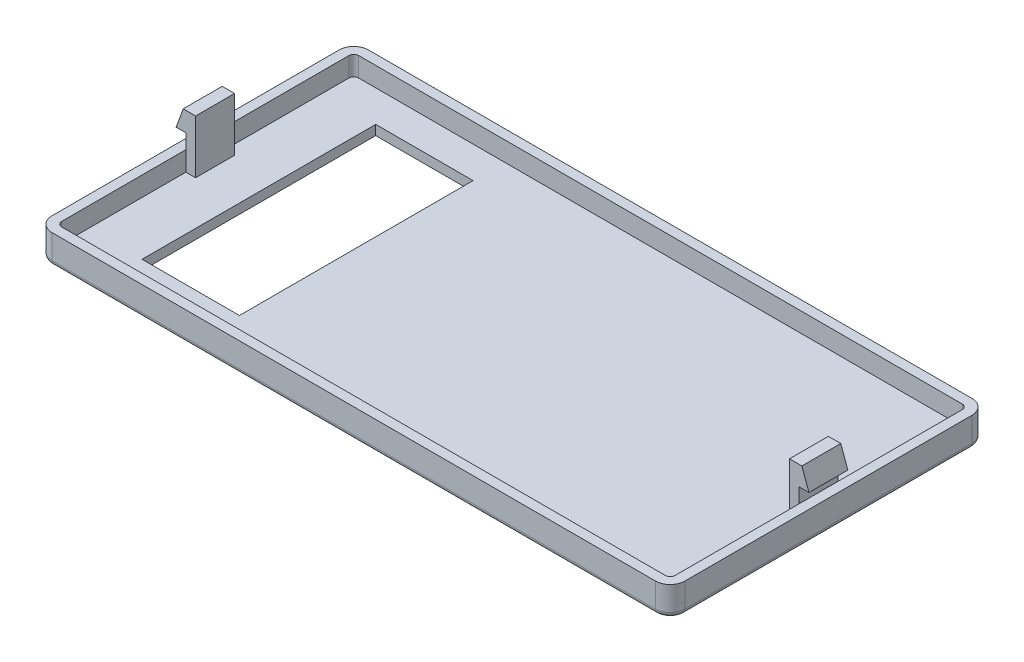
from build123d import *

# Parameters (mm, degrees)
SKETCH_1_W                  = 130
SKETCH_1_H                  = 65
EXTRUDE_1_DEPTH             = 6
SKETCH_2_W                  = 126
SKETCH_2_H                  = 61
CUT_EXTRUDE_1_DEPTH         = 4
FILLET_1_R                  = 1
SKETCH_9_W                  = 20
SKETCH_9_H                  = 48
CUT_EXTRUDE_3_DEPTH         = 2
SKETCH_6_W                  = 2
SKETCH_6_H                  = 8
EXTRUDE_2_DEPTH             = 11
SKETCH_12_W                 = 8
SKETCH_12_H                 = 4
EXTRUDE_4_DEPTH             = 2
CHAMFER_2_SIZE2             = 4
CHAMFER_2_SIZE              = 1.455880937
CHAMFER_2_OF_MIRROR_2_SIZE2 = 1.455880937
CHAMFER_2_OF_MIRROR_2_SIZE  = 4
FILLET_2_R                  = 1
FILLET_3_R                  = 3


# Some blends are built 0.0001 mm under size
with BuildPart() as part:
    # Эскиз1 → Бобышка-Вытянуть1 (new body)
    with BuildSketch(Plane(origin=(0, 0, 0), x_dir=(1, 0, 0), z_dir=(0, 1, 0))):
        Rectangle(SKETCH_1_W, SKETCH_1_H)
    extrude(amount=EXTRUDE_1_DEPTH)

    # Эскиз2 → Вырез-Вытянуть1 (cut)
    with BuildSketch(Plane(origin=(0, 6, 0), x_dir=(1, 0, 0), z_dir=(0, 1, 0))):
        Rectangle(SKETCH_2_W, SKETCH_2_H)
    extrude(amount=-CUT_EXTRUDE_1_DEPTH, mode=Mode.SUBTRACT)

    # Скругление1
    fillet_1_edges = [part.edges().sort_by_distance(p)[0] for p in [
        (0, 0, 32.5),
        (-65, 0, 0),
        (0, 0, -32.5),
        (65, 0, 0),
    ]]
    fillet(fillet_1_edges, radius=FILLET_1_R)

    # Эскиз9 → Вырез-Вытянуть3 (cut)
    with BuildSketch(Plane.XZ):
        with Locations((-42, 0)):
            Rectangle(SKETCH_9_W, SKETCH_9_H)
    extrude(amount=-CUT_EXTRUDE_3_DEPTH, mode=Mode.SUBTRACT)

    # Эскиз6 → Бобышка-Вытянуть2 (add)
    with BuildSketch(Plane(origin=(0, 2, 0), x_dir=(1, 0, 0), z_dir=(0, 1, 0))):
        with Locations((62, 0)):
            Rectangle(SKETCH_6_W, SKETCH_6_H)
    extrude_2 = extrude(amount=EXTRUDE_2_DEPTH)

    # Эскиз12 → Бобышка-Вытянуть4 (add)
    with BuildSketch(Plane(origin=(63, 0, 0), x_dir=(0, 0, -1), z_dir=(1, 0, 0))):
        with Locations((0, 11)):
            Rectangle(SKETCH_12_W, SKETCH_12_H)
    extrude_4 = extrude(amount=EXTRUDE_4_DEPTH)

    # Фаска2
    chamfer_2_edges = [part.edges().sort_by_distance(p)[0] for p in [
        (65, 13, 0),
    ]]
    chamfer_2_side = [part.faces().sort_by_distance(p)[0] for p in [
        (64.970882381, 13, 0),
    ]]
    chamfer(chamfer_2_edges, length=CHAMFER_2_SIZE - 0.0001, length2=CHAMFER_2_SIZE2 - 0.0001, reference=chamfer_2_side[0])  # a hair under: the kernel refuses the full size

    # Зеркальное отражение2: Бобышка-Вытянуть2, Бобышка-Вытянуть4 across plane
    add(extrude_2.mirror(Plane(origin=(0, 0, 0), x_dir=(0, 0, 1), z_dir=(1, 0, 0))))
    add(extrude_4.mirror(Plane(origin=(0, 0, 0), x_dir=(0, 0, 1), z_dir=(1, 0, 0))))

    # Фаска2 of Зеркальное отражение2
    chamfer_2_of_mirror_2_edges = [part.edges().sort_by_distance(p)[0] for p in [
        (-65, 13, 0),
    ]]
    chamfer_2_of_mirror_2_side = [part.faces().sort_by_distance(p)[0] for p in [
        (-65, 12.970882381, 0),
    ]]
    chamfer(chamfer_2_of_mirror_2_edges, length=CHAMFER_2_OF_MIRROR_2_SIZE - 0.0001, length2=CHAMFER_2_OF_MIRROR_2_SIZE2 - 0.0001, reference=chamfer_2_of_mirror_2_side[0])  # a hair under: the kernel refuses the full size

    # Скругление2
    fillet_2_edges = [part.edges().sort_by_distance(p)[0] for p in [
        (63, 4, -30.5),
        (63, 4, 30.5),
        (-63, 4, 30.5),
        (-63, 4, -30.5),
    ]]
    fillet(fillet_2_edges, radius=FILLET_2_R)

    # Скругление3
    # the kernel refuses this fillet: 3 mm, written as the material it takes off along each edge
    with BuildSketch(Plane(origin=(-62, 0, 29.5), x_dir=(0, 0, 1), z_dir=(1, 0, 0))) as fillet_3_piece_1:
        with BuildLine():
            CenterArc((2, -1), 1, 0, 90)
            Line((3, -1), (3, 0))
            Line((3, 0), (2, 0))
        make_face()
    revolve(axis=Axis((-62, 0, 29.5), (0, -1, 0)), revolution_arc=90, mode=Mode.SUBTRACT)
    with BuildSketch(Plane(origin=(-62, 0, -29.5), x_dir=(-1, 0, 0), z_dir=(0, 0, 1))) as fillet_3_piece_2:
        with BuildLine():
            CenterArc((2, -1), 1, 0, 90)
            Line((3, -1), (3, 0))
            Line((3, 0), (2, 0))
        make_face()
    revolve(axis=Axis((-62, 0, -29.5), (0, -1, 0)), revolution_arc=90, mode=Mode.SUBTRACT)
    with BuildSketch(Plane(origin=(62, 0, 29.5), x_dir=(1, 0, 0), z_dir=(0, 0, -1))) as fillet_3_piece_3:
        with BuildLine():
            CenterArc((2, -1), 1, 0, 90)
            Line((3, -1), (3, 0))
            Line((3, 0), (2, 0))
        make_face()
    revolve(axis=Axis((62, 0, 29.5), (0, -1, 0)), revolution_arc=90, mode=Mode.SUBTRACT)
    with BuildSketch(Plane(origin=(62, 0, -29.5), x_dir=(0, 0, -1), z_dir=(-1, 0, 0))) as fillet_3_piece_4:
        with BuildLine():
            CenterArc((2, -1), 1, 0, 90)
            Line((3, -1), (3, 0))
            Line((3, 0), (2, 0))
        make_face()
    revolve(axis=Axis((62, 0, -29.5), (0, -1, 0)), revolution_arc=90, mode=Mode.SUBTRACT)
    with BuildSketch(Plane(origin=(65, 0, 32.5), x_dir=(-1, 0, 0), z_dir=(0, 1, 0)), Plane(origin=(65, 0, -32.5), x_dir=(0, 0, 1), z_dir=(0, 1, 0))) as fillet_3_piece_5:
        with BuildLine():
            CenterArc((FILLET_3_R, -FILLET_3_R), FILLET_3_R, 90, 90)
            Line((0, -FILLET_3_R), (0, 0))
            Line((0, 0), (FILLET_3_R, 0))
        make_face()
    extrude(amount=13.5, mode=Mode.SUBTRACT)
    with BuildSketch(Plane(origin=(-65, 0, 32.5), x_dir=(1, 0, 0), z_dir=(0, 1, 0)), Plane(origin=(-65, 0, -32.5), x_dir=(0, 0, 1), z_dir=(0, 1, 0))) as fillet_3_piece_6:
        with BuildLine():
            CenterArc((FILLET_3_R, FILLET_3_R), FILLET_3_R, 180, 90)
            Line((0, FILLET_3_R), (0, 0))
            Line((0, 0), (FILLET_3_R, 0))
        make_face()
    extrude(amount=13.5, mode=Mode.SUBTRACT)


solid = part.part
